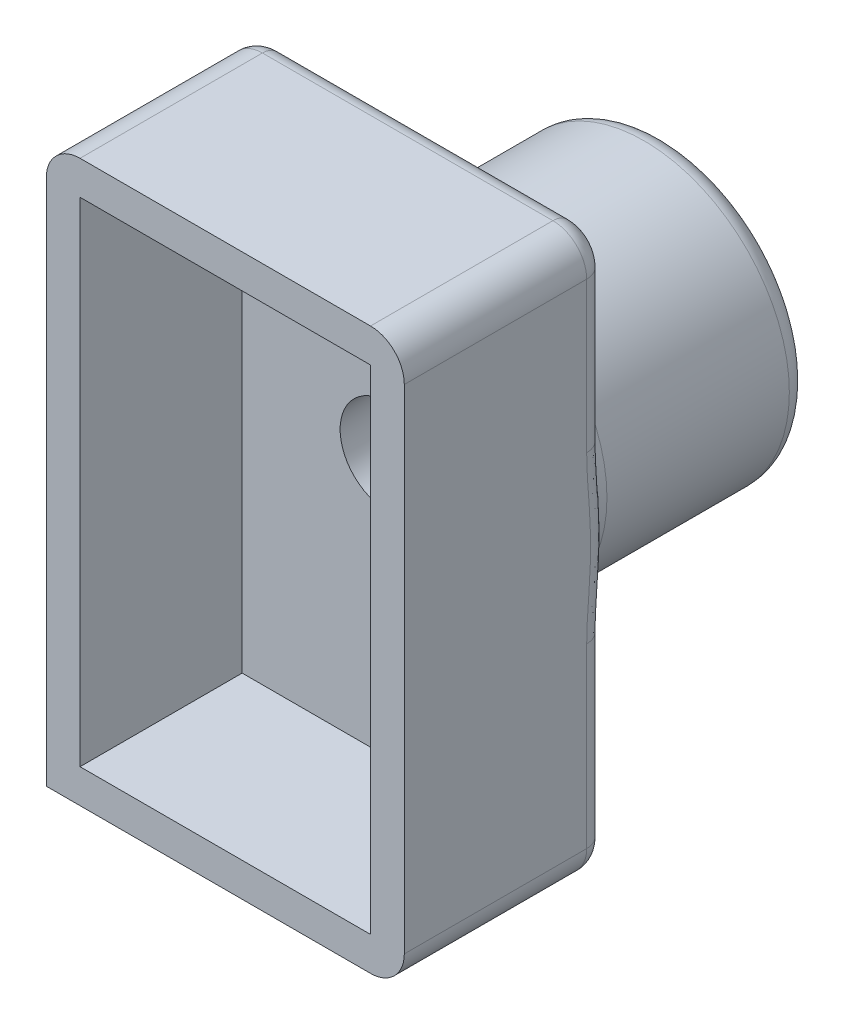
from build123d import *

# Parameters (mm, degrees)
SKETCH1_W           = 10.922
SKETCH1_H           = 18.542
BOSS_EXTRUDE1_DEPTH = 1.524
SKETCH3_R           = 5.461
SKETCH3_R_2         = 1.778
BOSS_EXTRUDE2_DEPTH = 8.89
SKETCH2_W           = 13.462
SKETCH2_H           = 21.082
SKETCH2_W_2         = 10.922
SKETCH2_H_2         = 18.542
EXTRUDE_THIN1_DEPTH = 7.62
CUT_EXTRUDE1_START  = -20.32
SKETCH4_R           = 1.778
CUT_EXTRUDE1_DEPTH  = 20.32
FILLET1_R           = 1.27
FILLET2_R           = 0.762
FILLET3_R           = 0.762
CUT_EXTRUDE2_DEPTH  = 0.635


with BuildPart() as part:
    # Sketch1 → Boss-Extrude1 (new body)
    with BuildSketch(Plane.XY):
        Rectangle(SKETCH1_W, SKETCH1_H)
    extrude(amount=BOSS_EXTRUDE1_DEPTH)

    # Sketch3 → Boss-Extrude2 (add)
    with BuildSketch(Plane.XY):
        with Locations((0, 0.508)):
            Circle(SKETCH3_R)
        with Locations((0, 0.508)):
            Circle(SKETCH3_R_2, mode=Mode.SUBTRACT)
    extrude(amount=-BOSS_EXTRUDE2_DEPTH)

    # Sketch2 → Extrude-Thin1 (add)
    with BuildSketch(Plane.XY):
        Rectangle(SKETCH2_W, SKETCH2_H)
        Rectangle(SKETCH2_W_2, SKETCH2_H_2, mode=Mode.SUBTRACT)
    extrude(amount=EXTRUDE_THIN1_DEPTH)

    # Sketch4 → Cut-Extrude1 (cut)
    with BuildSketch(Plane(origin=(0, 0, -8.89), x_dir=(-1, 0, 0), z_dir=(0, 0, -1)).offset(CUT_EXTRUDE1_START)):
        with Locations(Location((0, 0.508, 0), (0, 0, 180))):
            Circle(SKETCH4_R)
    extrude(amount=CUT_EXTRUDE1_DEPTH, mode=Mode.SUBTRACT)

    # Fillet1
    fillet1_edges = [part.edges().sort_by_distance(p)[0] for p in [
        (-5.461, 0.508, 0),
        (6.731, -10.541, 3.81),
        (6.731, 10.541, 3.81),
        (-6.731, 10.541, 3.81),
    ]]
    fillet(fillet1_edges, radius=FILLET1_R - 0.0001)  # a hair under: the kernel refuses the full size

    # Fillet2
    fillet2_edges = [part.edges().sort_by_distance(p)[0] for p in [
        (-5.461, 0.508, -8.89),
    ]]
    fillet(fillet2_edges, radius=FILLET2_R)

    # Fillet3
    fillet3_edges = [part.edges().sort_by_distance(p)[0] for p in [
        (-0.63495, -10.541, 0),
        (6.731, 0, 0),
        (6.731, 0, 0),
        (-6.731, -0.63495, 0),
        (-6.731, -0.63495, 0),
        (0, 10.541, 0),
        (-6.359054901, 10.169054901, 0),
        (6.359054901, 10.169054901, 0),
        (6.359054901, -10.169054901, 0),
    ]]
    fillet(fillet3_edges, radius=FILLET3_R)

    # Sketch5 → Cut-Extrude2 (cut)
    with BuildSketch(Plane(origin=(0, 0, 0), x_dir=(-1, 0, 0), z_dir=(0, 0, -1))):
        Polygon((3.390564192, -7.848738261), (5.164036584, -8.872653024), (5.164036584, -6.824823498), align=None)
    extrude(amount=-CUT_EXTRUDE2_DEPTH, mode=Mode.SUBTRACT)


solid = part.part
